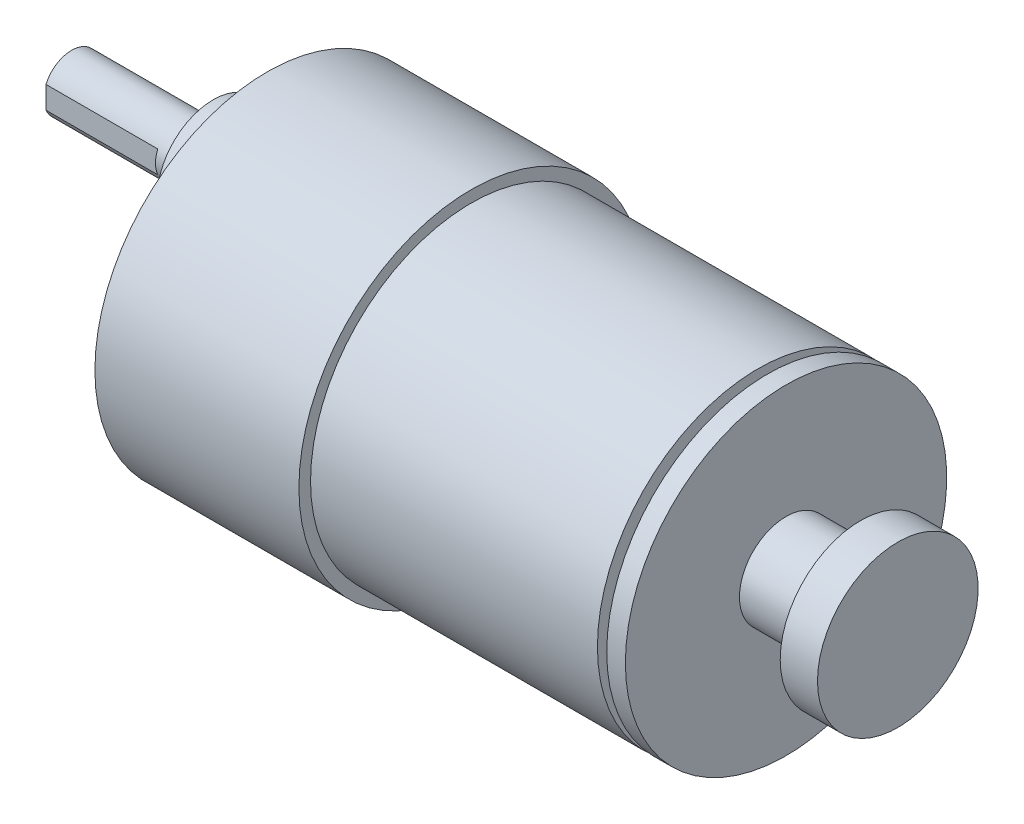
from build123d import *

# Parameters (mm, degrees)
CUT_EXTRUDE1_DEPTH        = 12
M3X0_5_TAPPED_HOLE1_D     = 2.5
M3X0_5_TAPPED_HOLE1_DEPTH = 8.5
M3X0_5_TAPPED_HOLE1_TIP   = 0.751075774
CUT_EXTRUDE2_DEPTH        = 2


with BuildPart() as part:
    # Sketch1 → MainBody (revolve)
    with BuildSketch(Plane.XY):
        Polygon((0, 0), (0, 8.625), (-4, 8.625), (-4, 5), (-12, 5), (-12, 17.25), (-14, 17.25), (-14, 5), (-15, 5), (-15, 17.25), (-45.8, 17.25), (-45.8, 18.5), (-67.7, 18.5), (-67.7, 0), align=None)
    revolve(axis=Axis((-80.111398028, 0, 0), (1, 0, 0)))

    # Sketch3 → SmallBoss (revolve)
    with BuildSketch(Plane.XY):
        Polygon((-67.7, 7), (-67.7, 13), (-73.5, 13), (-73.5, 10), (-88.7, 10), (-88.7, 7), align=None)
    revolve(axis=Axis((0, 7, 0), (-1, 0, 0)))

    # Sketch4 → Cut-Extrude1 (cut)
    with BuildSketch(Plane.ZY.offset(88.7)):
        with BuildLine():
            Line((-2.75, 5.801042119), (-2.75, 8.198957881))
            ThreePointArc((-2.75, 8.198957881), (-3, 7), (-2.75, 5.801042119))
        make_face()
        with BuildLine():
            ThreePointArc((2.75, 5.801042119), (3, 7), (2.75, 8.198957881))
            Line((2.75, 8.198957881), (2.75, 5.801042119))
        make_face()
    extrude(amount=-CUT_EXTRUDE1_DEPTH, mode=Mode.SUBTRACT)

    # M3x0.5 Tapped Hole1
    with Locations(Plane.ZY.offset(67.7)):
        with Locations((7.75, 13.423393759), (15.5, 0), (7.75, -13.423393759), (-7.75, -13.423393759), (-15.5, 0), (-7.75, 13.423393759)):
            Hole(M3X0_5_TAPPED_HOLE1_D / 2, depth=M3X0_5_TAPPED_HOLE1_DEPTH)
            with Locations((0, 0, -(M3X0_5_TAPPED_HOLE1_DEPTH + M3X0_5_TAPPED_HOLE1_TIP / 2))):  # 118° drill point
                Cone(0, M3X0_5_TAPPED_HOLE1_D / 2, M3X0_5_TAPPED_HOLE1_TIP, mode=Mode.SUBTRACT)

    # Sketch9 → Cut-Extrude2 (cut)
    with BuildSketch(Plane.ZY.offset(67.7)):
        with BuildLine():
            ThreePointArc((-9.324839925, 6.385470704), (-3.342227597, -10.796128493), (11.301631552, 0))
            ThreePointArc((11.301631552, 0), (10.796128493, 3.342227597), (9.324839925, 6.385470704))
            ThreePointArc((9.324839925, 6.385470704), (0, -2.345067463), (-9.324839925, 6.385470704))
        make_face()
    extrude(amount=-CUT_EXTRUDE2_DEPTH, mode=Mode.SUBTRACT)


solid = part.part
